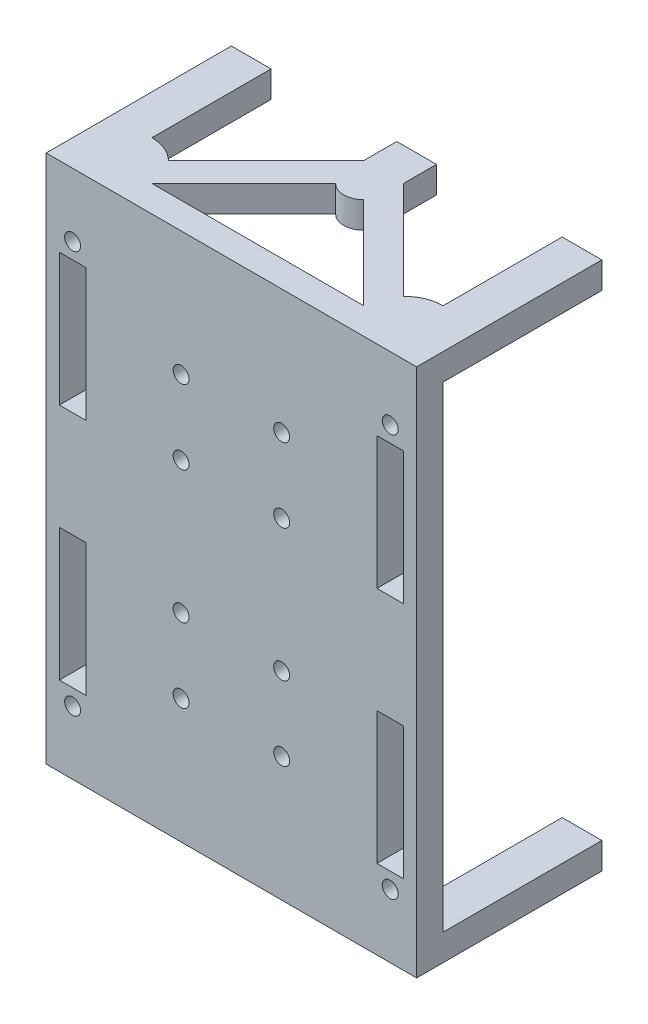
from build123d import *

# Parameters (mm, degrees)
SKETCH1_W           = 70
SKETCH1_H           = 100
BOSS_EXTRUDE1_DEPTH = 2.5
SKETCH2_R           = 1.5
CUT_EXTRUDE1_DEPTH  = 10
BOSS_EXTRUDE2_DEPTH = 5
SKETCH4_R           = 1.5
SKETCH4_W           = 5
SKETCH4_H           = 25
CUT_EXTRUDE2_DEPTH  = 5
SKETCH7_R           = 1.5
CUT_EXTRUDE3_DEPTH  = 5


with BuildPart() as part:
    # Sketch1 → Boss-Extrude1 (new, symmetric)
    with BuildSketch(Plane.XY):
        Rectangle(SKETCH1_W, SKETCH1_H)
    extrude(amount=BOSS_EXTRUDE1_DEPTH, both=True)

    # Sketch2 → Cut-Extrude1 (cut)
    with BuildSketch(Plane(origin=(0, 0, -2.5), x_dir=(-1, 0, 0), z_dir=(0, 0, -1))):
        with Locations((30, 38)):
            Circle(SKETCH2_R)
        with Locations((-30, 38)):
            Circle(SKETCH2_R)
        with Locations((30, -38)):
            Circle(SKETCH2_R)
        with Locations((-30, -38)):
            Circle(SKETCH2_R)
    extrude(amount=-CUT_EXTRUDE1_DEPTH, mode=Mode.SUBTRACT)

    # Sketch3 → Boss-Extrude2 (add)
    with BuildSketch(Plane(origin=(0, 50, 0), x_dir=(1, 0, 0), z_dir=(0, 1, 0))):
        with BuildLine():
            Line((-35, 2.5), (-35, 32.5))
            Line((-35, 32.5), (-27.5, 32.5))
            Line((-27.5, 32.5), (-27.5, 10))
            ThreePointArc((-27.5, 10), (-24.629874257, 9.429096494), (-22.196699141, 7.803300859))
            Line((-22.196699141, 7.803300859), (-3.75, 26.25))
            Line((-3.75, 26.25), (-3.75, 32.5))
            Line((-3.75, 32.5), (3.75, 32.5))
            Line((3.75, 32.5), (3.75, 26.25))
            Line((3.75, 26.25), (22.196699141, 7.803300859))
            ThreePointArc((22.196699141, 7.803300859), (24.629874257, 9.429096494), (27.5, 10))
            Line((27.5, 10), (27.5, 32.5))
            Line((27.5, 32.5), (35, 32.5))
            Line((35, 32.5), (35, 2.5))
            Line((35, 2.5), (20, 2.5))
            Line((20, 2.5), (2.651650429, 19.848349571))
            ThreePointArc((2.651650429, 19.848349571), (0, 18.75), (-2.651650429, 19.848349571))
            Line((-2.651650429, 19.848349571), (-20, 2.5))
            Line((-20, 2.5), (-35, 2.5))
        make_face()
    boss_extrude2 = extrude(amount=-BOSS_EXTRUDE2_DEPTH)

    # Mirror1: Boss-Extrude2 across plane
    add(boss_extrude2.mirror(Plane.ZX))

    # Sketch4 → Cut-Extrude2 (cut)
    with BuildSketch(Plane(origin=(0, 0, -2.5), x_dir=(-1, 0, 0), z_dir=(0, 0, -1))):
        with Locations((-9.5, 26.5)):
            Circle(SKETCH4_R)
        with Locations((-9.5, 12.5)):
            Circle(SKETCH4_R)
        with Locations((30, 22.5)):
            Rectangle(SKETCH4_W, SKETCH4_H)
        with Locations((-30, 22.5)):
            Rectangle(SKETCH4_W, SKETCH4_H)
        with Locations((30, -22.5)):
            Rectangle(SKETCH4_W, SKETCH4_H)
        with Locations((-30, -22.5)):
            Rectangle(SKETCH4_W, SKETCH4_H)
        with Locations((9.5, 12.5)):
            Circle(SKETCH4_R)
        with Locations((9.5, 26.5)):
            Circle(SKETCH4_R)
        with Locations((9.5, -12.5)):
            Circle(SKETCH4_R)
        with Locations((9.5, -26.5)):
            Circle(SKETCH4_R)
        with Locations((-9.5, -26.5)):
            Circle(SKETCH4_R)
        with Locations((-9.5, -12.5)):
            Circle(SKETCH4_R)
    extrude(amount=-CUT_EXTRUDE2_DEPTH, mode=Mode.SUBTRACT)

    # Sketch7 → Cut-Extrude3 (cut)
    with BuildSketch(Plane(origin=(0, 0, -32.5), x_dir=(-1, 0, 0), z_dir=(0, 0, -1))):
        with Locations((0, 47.5)):
            Circle(SKETCH7_R)
        with Locations((-31.25, 47.5)):
            Circle(SKETCH7_R)
        with Locations((31.25, 47.5)):
            Circle(SKETCH7_R)
    cut_extrude3 = extrude(amount=-CUT_EXTRUDE3_DEPTH, mode=Mode.SUBTRACT)

    # Mirror2: Cut-Extrude3 across plane
    add(cut_extrude3.mirror(Plane.ZX), mode=Mode.SUBTRACT)


solid = part.part
